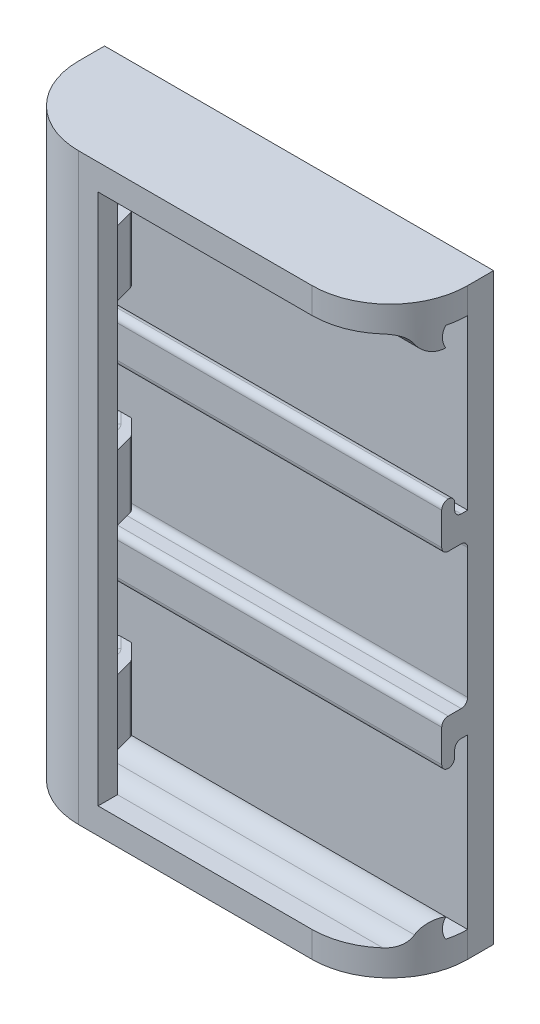
from build123d import *

# Parameters (mm, degrees)
SKETCH1_W                       = 30
SKETCH1_H                       = 45
BOSS_EXTRUDE1_DEPTH             = 2
BOSS_EXTRUDE2_REACH             = 29.115
BOSS_EXTRUDE2_DIRECTION_2_REACH = 29.115
BOSS_EXTRUDE3_START             = 20.5
SKETCH2_3_W                     = 1.5
SKETCH2_3_H                     = 4.5
SKETCH2_3_H_2                   = 1.5
BOSS_EXTRUDE3_DEPTH             = 2
BOSS_EXTRUDE4_START             = -22.5
SKETCH2_4_W                     = 1.5
SKETCH2_4_H                     = 4.5
SKETCH2_4_H_2                   = 1.5
BOSS_EXTRUDE4_DEPTH             = 2
BOSS_EXTRUDE5_REACH             = 30.2
SKETCH3_W                       = 6
SKETCH3_H                       = 2
SKETCH3_W_2                     = 2
SKETCH3_W_3                     = 1
SKETCH3_H_2                     = 1.5
BOSS_EXTRUDE5_DIRECTION_2_REACH = 30.2
FILLET1_R                       = 6
FILLET3_R                       = 0.5
BOSS_EXTRUDE6_DEPTH             = 2.5
FILLET4_R                       = 0.5
LPATTERN2_COUNT                 = 2
LPATTERN2_PITCH                 = 15
LPATTERN2_COUNT_DIR2            = 2
LPATTERN2_PITCH_DIR2            = 15
FILLET4_OF_LPATTERN2_R          = 0.5


with BuildPart() as part:
    # Sketch1 → Boss-Extrude1 (new body)
    with BuildSketch(Plane.XY):
        Rectangle(SKETCH1_W, SKETCH1_H)
    extrude(amount=BOSS_EXTRUDE1_DEPTH)

    # Boss-Extrude2: up to this face of the body (flat: up to its plane)
    boss_extrude2_end = Plane(part.part.faces().sort_by_distance((0, 22.5, 1))[0])
    # Sketch2 → Boss-Extrude2 (add, up to the picked face)
    with BuildSketch(Plane(origin=(0, 0, 0), x_dir=(1, 0, 0), z_dir=(0, 1, 0)), mode=Mode.PRIVATE) as boss_extrude2_sk1:
        with BuildLine():
            ThreePointArc((-15, -2), (-13.242640687, -6.242640687), (-9, -8))
            Line((-9, -8), (-7.5, -8))
            Line((-7.5, -8), (-7.5, -6.5))
            Line((-7.5, -6.5), (-9, -6.5))
            ThreePointArc((-9, -6.5), (-12.181980515, -5.181980515), (-13.5, -2))
            Line((-13.5, -2), (-15, -2))
        make_face()
    boss_extrude2_tool1 = split(extrude(boss_extrude2_sk1.sketch, amount=BOSS_EXTRUDE2_REACH, mode=Mode.PRIVATE), bisect_by=boss_extrude2_end, keep=Keep.BOTH, mode=Mode.PRIVATE)
    add(boss_extrude2_tool1.solids().sort_by(Axis((-11.731699, 0, 5.65509), (0, 1, 0)))[0])

    # Boss-Extrude2 direction 2: up to this face of the body (flat: up to its plane)
    boss_extrude2_direction_2_end = Plane(part.part.faces().sort_by_distance((0, -22.5, 1))[0])
    # Sketch2 → Boss-Extrude2 direction 2 (add, up to the picked face)
    with BuildSketch(Plane(origin=(0, 0, 0), x_dir=(1, 0, 0), z_dir=(0, 1, 0)), mode=Mode.PRIVATE) as boss_extrude2_direction_2_sk1:
        with BuildLine():
            ThreePointArc((-15, -2), (-13.242640687, -6.242640687), (-9, -8))
            Line((-9, -8), (-7.5, -8))
            Line((-7.5, -8), (-7.5, -6.5))
            Line((-7.5, -6.5), (-9, -6.5))
            ThreePointArc((-9, -6.5), (-12.181980515, -5.181980515), (-13.5, -2))
            Line((-13.5, -2), (-15, -2))
        make_face()
    boss_extrude2_direction_2_tool1 = split(extrude(boss_extrude2_direction_2_sk1.sketch, amount=-BOSS_EXTRUDE2_DIRECTION_2_REACH, mode=Mode.PRIVATE), bisect_by=boss_extrude2_direction_2_end, keep=Keep.BOTH, mode=Mode.PRIVATE)
    add(boss_extrude2_direction_2_tool1.solids().sort_by(Axis((-11.731699, 0, 5.65509), (0, -1, 0)))[0])

    # Sketch2<3> → Boss-Extrude3 (add)
    with BuildSketch(Plane(origin=(0, 0, 0), x_dir=(1, 0, 0), z_dir=(0, 1, 0)).offset(BOSS_EXTRUDE3_START)):
        with BuildLine():
            ThreePointArc((-13.5, -2), (-12.181980515, -5.181980515), (-9, -6.5))
            Line((-9, -6.5), (-9, -2))
            Line((-9, -2), (-13.5, -2))
        make_face()
        with BuildLine():
            ThreePointArc((-15, -2), (-13.242640687, -6.242640687), (-9, -8))
            Line((-9, -8), (-9, -6.5))
            ThreePointArc((-9, -6.5), (-12.181980515, -5.181980515), (-13.5, -2))
            Line((-13.5, -2), (-15, -2))
        make_face()
        with Locations((-8.25, -4.25)):
            Rectangle(SKETCH2_3_W, SKETCH2_3_H)
        with Locations((-8.25, -7.25)):
            Rectangle(SKETCH2_3_W, SKETCH2_3_H_2)
    extrude(amount=BOSS_EXTRUDE3_DEPTH)

    # Sketch2<4> → Boss-Extrude4 (add)
    with BuildSketch(Plane(origin=(0, 0, 0), x_dir=(1, 0, 0), z_dir=(0, 1, 0)).offset(BOSS_EXTRUDE4_START)):
        with BuildLine():
            ThreePointArc((-15, -2), (-13.242640687, -6.242640687), (-9, -8))
            Line((-9, -8), (-9, -6.5))
            ThreePointArc((-9, -6.5), (-12.181980515, -5.181980515), (-13.5, -2))
            Line((-13.5, -2), (-15, -2))
        make_face()
        with BuildLine():
            ThreePointArc((-13.5, -2), (-12.181980515, -5.181980515), (-9, -6.5))
            Line((-9, -6.5), (-9, -2))
            Line((-9, -2), (-13.5, -2))
        make_face()
        with Locations((-8.25, -4.25)):
            Rectangle(SKETCH2_4_W, SKETCH2_4_H)
        with Locations((-8.25, -7.25)):
            Rectangle(SKETCH2_4_W, SKETCH2_4_H_2)
    extrude(amount=BOSS_EXTRUDE4_DEPTH)

    # Boss-Extrude5: up to this face of the body (flat: up to its plane)
    boss_extrude5_end = Plane(part.part.faces().sort_by_distance((15, 0, 1))[0])
    # Sketch3 → Boss-Extrude5 (add, up to the picked face)
    with BuildSketch(Plane(origin=(0, 0, 0), x_dir=(0, 0, -1), z_dir=(1, 0, 0)), mode=Mode.PRIVATE) as boss_extrude5_sk1:
        with Locations((-5, 21.5)):
            Rectangle(SKETCH3_W, SKETCH3_H)
    boss_extrude5_tool1 = split(extrude(boss_extrude5_sk1.sketch, amount=BOSS_EXTRUDE5_REACH, mode=Mode.PRIVATE), bisect_by=boss_extrude5_end, keep=Keep.BOTH, mode=Mode.PRIVATE)
    # Sketch3 → Boss-Extrude5 (add, up to the picked face)
    with BuildSketch(Plane(origin=(0, 0, 0), x_dir=(0, 0, -1), z_dir=(1, 0, 0)), mode=Mode.PRIVATE) as boss_extrude5_sk2:
        with BuildLine():
            ThreePointArc((-3.5, 19), (-3.700961894, 19.75), (-3.5, 20.5))
            Line((-3.5, 20.5), (-6.5, 20.5))
            ThreePointArc((-6.5, 20.5), (-5.738185248, 20.292144838), (-5.1875, 19.726184377))
            ThreePointArc((-5.1875, 19.726184377), (-4.467927061, 19.074530775), (-3.5, 19))
        make_face()
    boss_extrude5_tool2 = split(extrude(boss_extrude5_sk2.sketch, amount=BOSS_EXTRUDE5_REACH, mode=Mode.PRIVATE), bisect_by=boss_extrude5_end, keep=Keep.BOTH, mode=Mode.PRIVATE)
    # Sketch3 → Boss-Extrude5 (add, up to the picked face)
    with BuildSketch(Plane(origin=(0, 0, 0), x_dir=(0, 0, -1), z_dir=(1, 0, 0)), mode=Mode.PRIVATE) as boss_extrude5_sk3:
        with Locations((-3, 6.5)):
            Rectangle(SKETCH3_W_2, SKETCH3_H)
    boss_extrude5_tool3 = split(extrude(boss_extrude5_sk3.sketch, amount=BOSS_EXTRUDE5_REACH, mode=Mode.PRIVATE), bisect_by=boss_extrude5_end, keep=Keep.BOTH, mode=Mode.PRIVATE)
    # Sketch3 → Boss-Extrude5 (add, up to the picked face)
    with BuildSketch(Plane(origin=(0, 0, 0), x_dir=(0, 0, -1), z_dir=(1, 0, 0)), mode=Mode.PRIVATE) as boss_extrude5_sk4:
        with Locations((-3.5, 8.25)):
            Rectangle(SKETCH3_W_3, SKETCH3_H_2)
    boss_extrude5_tool4 = split(extrude(boss_extrude5_sk4.sketch, amount=BOSS_EXTRUDE5_REACH, mode=Mode.PRIVATE), bisect_by=boss_extrude5_end, keep=Keep.BOTH, mode=Mode.PRIVATE)
    boss_extrude5_1 = boss_extrude5_tool1.solids().sort_by(Axis((0, 21.5, 5), (1, 0, 0)))[0]
    add(boss_extrude5_1)
    boss_extrude5_2 = boss_extrude5_tool2.solids().sort_by(Axis((0, 19.862294, 4.485839), (1, 0, 0)))[0]
    add(boss_extrude5_2)
    boss_extrude5_3 = boss_extrude5_tool3.solids().sort_by(Axis((0, 6.5, 3), (1, 0, 0)))[0]
    add(boss_extrude5_3)
    boss_extrude5_4 = boss_extrude5_tool4.solids().sort_by(Axis((0, 8.25, 3.5), (1, 0, 0)))[0]
    add(boss_extrude5_4)
    boss_extrude5 = boss_extrude5_1 + boss_extrude5_2 + boss_extrude5_3 + boss_extrude5_4  # Boss-Extrude5 as one shape, for the pattern or mirror that repeats it

    # Sketch3 → Boss-Extrude5 direction 2 (add, up to next)
    with BuildSketch(Plane(origin=(0, 0, 0), x_dir=(0, 0, -1), z_dir=(1, 0, 0)), mode=Mode.PRIVATE) as boss_extrude5_direction_2_sk1:
        with Locations((-5, 21.5)):
            Rectangle(SKETCH3_W, SKETCH3_H)
    boss_extrude5_direction_2_tool1 = extrude(boss_extrude5_direction_2_sk1.sketch, amount=-BOSS_EXTRUDE5_DIRECTION_2_REACH, mode=Mode.PRIVATE) - part.part
    # Sketch3 → Boss-Extrude5 direction 2 (add, up to next)
    with BuildSketch(Plane(origin=(0, 0, 0), x_dir=(0, 0, -1), z_dir=(1, 0, 0)), mode=Mode.PRIVATE) as boss_extrude5_direction_2_sk2:
        with BuildLine():
            ThreePointArc((-3.5, 19), (-3.700961894, 19.75), (-3.5, 20.5))
            Line((-3.5, 20.5), (-6.5, 20.5))
            ThreePointArc((-6.5, 20.5), (-5.738185248, 20.292144838), (-5.1875, 19.726184377))
            ThreePointArc((-5.1875, 19.726184377), (-4.467927061, 19.074530775), (-3.5, 19))
        make_face()
    boss_extrude5_direction_2_tool2 = extrude(boss_extrude5_direction_2_sk2.sketch, amount=-BOSS_EXTRUDE5_DIRECTION_2_REACH, mode=Mode.PRIVATE) - part.part
    # Sketch3 → Boss-Extrude5 direction 2 (add, up to next)
    with BuildSketch(Plane(origin=(0, 0, 0), x_dir=(0, 0, -1), z_dir=(1, 0, 0)), mode=Mode.PRIVATE) as boss_extrude5_direction_2_sk3:
        with Locations((-3, 6.5)):
            Rectangle(SKETCH3_W_2, SKETCH3_H)
    boss_extrude5_direction_2_tool3 = extrude(boss_extrude5_direction_2_sk3.sketch, amount=-BOSS_EXTRUDE5_DIRECTION_2_REACH, mode=Mode.PRIVATE) - part.part
    # Sketch3 → Boss-Extrude5 direction 2 (add, up to next)
    with BuildSketch(Plane(origin=(0, 0, 0), x_dir=(0, 0, -1), z_dir=(1, 0, 0)), mode=Mode.PRIVATE) as boss_extrude5_direction_2_sk4:
        with Locations((-3.5, 8.25)):
            Rectangle(SKETCH3_W_3, SKETCH3_H_2)
    boss_extrude5_direction_2_tool4 = extrude(boss_extrude5_direction_2_sk4.sketch, amount=-BOSS_EXTRUDE5_DIRECTION_2_REACH, mode=Mode.PRIVATE) - part.part
    boss_extrude5_direction_2_1 = boss_extrude5_direction_2_tool1.solids().sort_by_distance((0, 21.5, 5))[0]
    add(boss_extrude5_direction_2_1)
    boss_extrude5_direction_2_2 = boss_extrude5_direction_2_tool2.solids().sort_by_distance((0, 19.862294, 4.485839))[0]
    add(boss_extrude5_direction_2_2)
    boss_extrude5_direction_2_3 = boss_extrude5_direction_2_tool3.solids().sort_by_distance((0, 6.5, 3))[0]
    add(boss_extrude5_direction_2_3)
    boss_extrude5_direction_2_4 = boss_extrude5_direction_2_tool4.solids().sort_by_distance((0, 8.25, 3.5))[0]
    add(boss_extrude5_direction_2_4)
    boss_extrude5_direction_2 = boss_extrude5_direction_2_1 + boss_extrude5_direction_2_2 + boss_extrude5_direction_2_3 + boss_extrude5_direction_2_4  # Boss-Extrude5 direction 2 as one shape, for the pattern or mirror that repeats it

    # Mirror2: Boss-Extrude5, Boss-Extrude5 direction 2 across plane
    add(boss_extrude5.mirror(Plane.ZX))
    add(boss_extrude5_direction_2.mirror(Plane.ZX))

    # Fillet1
    fillet1_edges = [part.edges().sort_by_distance(p)[0] for p in [
        (15, 21.5, 8),
        (15, -21.5, 8),
    ]]
    fillet(fillet1_edges, radius=FILLET1_R)

    # Fillet3
    fillet3_edges = [part.edges().sort_by_distance(p)[0] for p in [
        (0.806258903, 7.5, 3),
        (0.806258903, -7.5, 3),
        (0.75, -5.5, 2),
        (0.75, 5.5, 2),
        (0.984435563, 5.5, 4),
        (0.984435563, -5.5, 4),
        (0.806258903, -9, 3),
        (0.806258903, 9, 3),
        (0.984435563, 9, 4),
        (0.984435563, -9, 4),
    ]]
    fillet(fillet3_edges, radius=FILLET3_R - 0.0001)  # a hair under: the kernel refuses the full size

    # Sketch5 → Boss-Extrude6 (add, symmetric)
    with BuildSketch(Plane(origin=(0, 0, 0), x_dir=(1, 0, 0), z_dir=(0, 1, 0))):
        Polygon((-9.388228568, -5.051111261), (-9, -6.5), (-7.5, -6.5), (-7.888228568, -5.051111261), (-9.138228568, -3.801111261), (-10.638228568, -3.801111261), align=None)
    boss_extrude6 = extrude(amount=BOSS_EXTRUDE6_DEPTH, both=True)

    # Fillet4
    fillet4_edges = [part.edges().sort_by_distance(p)[0] for p in [
        (-9.194114284, -2.5, 5.77555563),
        (-9.388228568, 0, 5.051111261),
        (-7.888228568, 0, 5.051111261),
        (-10.013228568, -2.5, 4.426111261),
        (-9.194114284, 2.5, 5.77555563),
        (-10.013228568, 2.5, 4.426111261),
    ]]
    fillet(fillet4_edges, radius=FILLET4_R)

    # LPattern2: Boss-Extrude6 2 × 2, 1 skipped
    with Locations(*[Vector(0, 1, 0) * (i * LPATTERN2_PITCH) + Vector(0, -1, 0) * (j * LPATTERN2_PITCH_DIR2) for i in range(LPATTERN2_COUNT) for j in range(LPATTERN2_COUNT_DIR2) if (i, j) not in ((0, 0), (1, 1))]):
        add(boss_extrude6)

    # Fillet4 of LPattern2
    fillet4_of_lpattern2_edges = [part.edges().sort_by_distance(p)[0] for p in [
        (-9.194114284, -17.5, 5.77555563),
        (-9.388228568, -15, 5.051111261),
        (-7.888228568, -15, 5.051111261),
        (-10.013228568, -17.5, 4.426111261),
        (-9.194114284, -12.5, 5.77555563),
        (-10.013228568, -12.5, 4.426111261),
        (-9.194114284, 12.5, 5.77555563),
        (-9.388228568, 15, 5.051111261),
        (-7.888228568, 15, 5.051111261),
        (-10.013228568, 12.5, 4.426111261),
        (-9.194114284, 17.5, 5.77555563),
        (-10.013228568, 17.5, 4.426111261),
    ]]
    fillet(fillet4_of_lpattern2_edges, radius=FILLET4_OF_LPATTERN2_R)


solid = part.part
